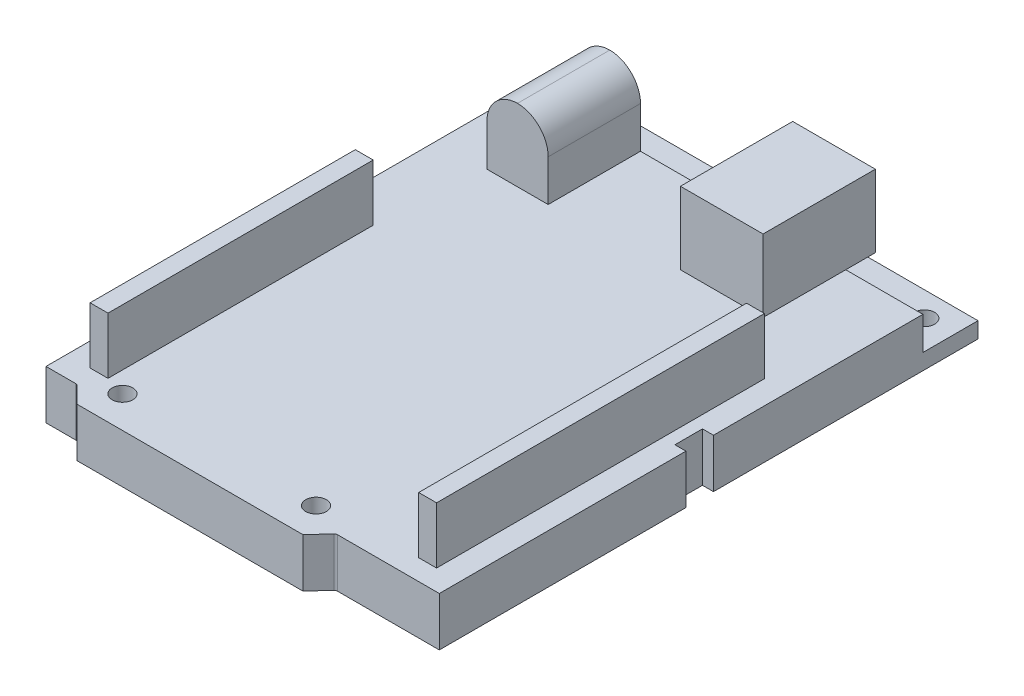
from build123d import *

# Parameters (mm, degrees)
SKETCH_1_W               = 57.1
SKETCH_1_H               = 80.7
EXTRUDE_1_DEPTH          = 7.1
SKETCH_3_W               = 57.1
SKETCH_3_H               = 8
CUT_EXTRUDE_2_DEPTH      = 4.8
CUT_EXTRUDE_3_DEPTH      = 100.112612719
SKETCH_5_W               = 1.6
SKETCH_5_H               = 4
CUT_EXTRUDE_4_DEPTH      = 100.112612719
SKETCH_6_W               = 1.6
SKETCH_6_H               = 4
EXTRUDE_2_DEPTH          = 7.1
SKETCH_7_W               = 2.6
SKETCH_7_H               = 47.6
SKETCH_7_H_2             = 38.5
EXTRUDE_3_DEPTH          = 8.2
SKETCH_8_W               = 12
SKETCH_8_H               = 16.3
EXTRUDE_4_DEPTH          = 10.5
SKETCH_9_W               = 4.45
SKETCH_9_H               = 3
EXTRUDE_5_DEPTH          = 10.5
SKETCH_10_W              = 8.9
SKETCH_10_H              = 10.4
EXTRUDE_6_DEPTH          = 10.5
FILLET_1_R               = 4.5
CUT_EXTRUDE_7_DEPTH      = 101.034943895
CUT_EXTRUDE_7_DEPTH_BACK = 101.034943895
SKETCH_11_R              = 1.5


with BuildPart() as part:
    # 草图1 → 凸台-拉伸1 (new body)
    with BuildSketch(Plane(origin=(0, 0, 0), x_dir=(1, 0, 0), z_dir=(0, 1, 0))):
        with Locations((28.55, 40.35)):
            Rectangle(SKETCH_1_W, SKETCH_1_H)
    extrude(amount=EXTRUDE_1_DEPTH)

    # 草图3 → 切除-拉伸2 (cut)
    with BuildSketch(Plane(origin=(0, 7.1, 0), x_dir=(1, 0, 0), z_dir=(0, 1, 0))):
        with Locations((28.55, 76.7)):
            Rectangle(SKETCH_3_W, SKETCH_3_H)
    extrude(amount=-CUT_EXTRUDE_2_DEPTH, mode=Mode.SUBTRACT)

    # 草图4 → 切除-拉伸3 (cut, through all)
    with BuildSketch(Plane(origin=(0, 7.1, 0), x_dir=(1, 0, 0), z_dir=(0, 1, 0))):
        with BuildLine():
            Line((57.1, 0), (57.1, 2.5))
            Line((57.1, 2.5), (42.31941151, 2.5))
            ThreePointArc((42.31941151, 2.5), (42.118493782, 2.457855945), (41.951446004, 2.338528265))
            Line((41.951446004, 2.338528265), (39.8, 0))
            Line((39.8, 0), (57.1, 0))
        make_face()
        with BuildLine():
            Line((0, 2.5), (4.292893219, 2.5))
            ThreePointArc((4.292893219, 2.5), (4.484234935, 2.461939766), (4.646446609, 2.353553391))
            Line((4.646446609, 2.353553391), (7, 0))
            Line((7, 0), (0, 0))
            Line((0, 0), (0, 2.5))
        make_face()
    extrude(amount=-CUT_EXTRUDE_3_DEPTH, mode=Mode.SUBTRACT)

    # 草图5 → 切除-拉伸4 (cut, through all)
    with BuildSketch(Plane(origin=(0, 7.1, 0), x_dir=(1, 0, 0), z_dir=(0, 1, 0))):
        with Locations((56.3, 40.3)):
            Rectangle(SKETCH_5_W, SKETCH_5_H)
    extrude(amount=-CUT_EXTRUDE_4_DEPTH, mode=Mode.SUBTRACT)

    # 草图6 → 凸台-拉伸2 (add)
    with BuildSketch(Plane(origin=(0, 7.1, 0), x_dir=(1, 0, 0), z_dir=(0, 1, 0))):
        with Locations((-0.8, 40.3)):
            Rectangle(SKETCH_6_W, SKETCH_6_H)
    extrude(amount=-EXTRUDE_2_DEPTH)

    # 草图7 → 凸台-拉伸3 (add)
    with BuildSketch(Plane(origin=(0, 7.1, 0), x_dir=(1, 0, 0), z_dir=(0, 1, 0))):
        with Locations((52.4, 29.3)):
            Rectangle(SKETCH_7_W, SKETCH_7_H)
        with Locations((4.7, 24.75)):
            Rectangle(SKETCH_7_W, SKETCH_7_H_2)
    extrude(amount=EXTRUDE_3_DEPTH)

    # 草图8 → 凸台-拉伸4 (add)
    with BuildSketch(Plane(origin=(0, 7.1, 0), x_dir=(1, 0, 0), z_dir=(0, 1, 0))):
        with Locations((39.9, 68.85)):
            Rectangle(SKETCH_8_W, SKETCH_8_H)
    extrude(amount=EXTRUDE_4_DEPTH)

    # 草图9 → 凸台-拉伸5 (add)
    with BuildSketch(Plane(origin=(0, 7.1, 0), x_dir=(1, 0, 0), z_dir=(0, 1, 0))):
        with Locations((13.875, 71.2)):
            Rectangle(SKETCH_9_W, SKETCH_9_H)
        with Locations((9.425, 71.2)):
            Rectangle(SKETCH_9_W, SKETCH_9_H)
    extrude(amount=EXTRUDE_5_DEPTH)

    # 草图10 → 凸台-拉伸6 (add)
    with BuildSketch(Plane(origin=(0, 7.1, 0), x_dir=(1, 0, 0), z_dir=(0, 1, 0))):
        with Locations((11.65, 64.5)):
            Rectangle(SKETCH_10_W, SKETCH_10_H)
    extrude(amount=EXTRUDE_6_DEPTH)

    # 圆角1
    # the kernel refuses this fillet: 4.5 mm, written as the material it takes off along each edge
    with BuildSketch(Plane(origin=(7.2, 17.6, -48.05), x_dir=(0, -1, 0), z_dir=(0, 0, -1))) as fillet_1_piece_1:
        with BuildLine():
            CenterArc((FILLET_1_R, -FILLET_1_R), FILLET_1_R, 90, 90)
            Line((0, -FILLET_1_R), (0, 0))
            Line((0, 0), (FILLET_1_R, 0))
        make_face()
    extrude(amount=35.9, mode=Mode.SUBTRACT)
    with BuildSketch(Plane(origin=(16.1, 17.6, -83.95), x_dir=(-1, 0, 0), z_dir=(0, 0, 1))) as fillet_1_piece_2:
        with BuildLine():
            CenterArc((FILLET_1_R, FILLET_1_R), FILLET_1_R, 180, 90)
            Line((0, FILLET_1_R), (0, 0))
            Line((0, 0), (FILLET_1_R, 0))
        make_face()
    extrude(amount=35.9, mode=Mode.SUBTRACT)

    # 草图11 → 切除-拉伸7 (cut, two sides: drawn at the far end of the back side and taken through both)
    with BuildSketch(Plane(origin=(0, 2.3, 0), x_dir=(1, 0, 0), z_dir=(0, 1, 0)).offset(-CUT_EXTRUDE_7_DEPTH_BACK)):
        with Locations(Location((52.9, 77.1, 0), (0, 0, 270))):
            Circle(SKETCH_11_R)
        with Locations(Location((4.2, 77.1, 0), (0, 0, 270))):
            Circle(SKETCH_11_R)
        with Locations(Location((37.1, 4.6, 0), (0, 0, 270))):
            Circle(SKETCH_11_R)
        with Locations(Location((9, 4.6, 0), (0, 0, 270))):
            Circle(SKETCH_11_R)
    extrude(amount=CUT_EXTRUDE_7_DEPTH + CUT_EXTRUDE_7_DEPTH_BACK, mode=Mode.SUBTRACT)


solid = part.part
